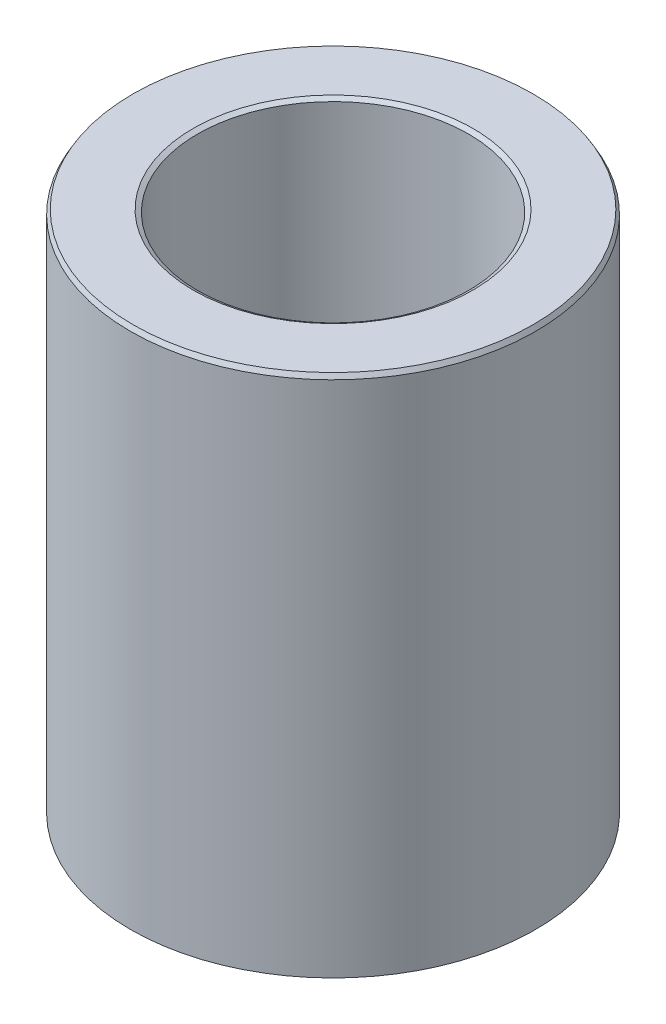
from build123d import *
from OCP.BRepFilletAPI import BRepFilletAPI_MakeChamfer

# Parameters (mm, degrees)
SKETCH1_R           = 40
BOSS_EXTRUDE1_DEPTH = 103.689007671
SKETCH2_R           = 26.766867874
CUT_EXTRUDE1_DEPTH  = 119.116088285
CHAMFER1_SIZE       = 0.879911126
CHAMFER1_SIZE2      = 0.508016925


with BuildPart() as part:
    # Sketch1 → Boss-Extrude1 (new body)
    with BuildSketch(Plane(origin=(0, 0, 0), x_dir=(1, 0, 0), z_dir=(0, 1, 0))):
        Circle(SKETCH1_R)
    extrude(amount=BOSS_EXTRUDE1_DEPTH)

    # Sketch2 → Cut-Extrude1 (cut, through all)
    with BuildSketch(Plane(origin=(0, 0, 0), x_dir=(1, 0, 0), z_dir=(0, 1, 0))):
        Circle(SKETCH2_R)
    extrude(amount=CUT_EXTRUDE1_DEPTH, mode=Mode.SUBTRACT)

    # Chamfer1: one chamfer whose edges measure the first distance from different faces: ONE call of the kernel's chamfer builder (chamfer() names one face for all edges)
    chamfer1_edges_1 = [part.edges().sort_by_distance(p)[0] for p in [
        (-26.766867874, 103.689007671, 0),
    ]]
    chamfer1_side_1 = [part.faces().sort_by_distance(p)[0] for p in [
        (-38.86862915, 103.689007671, 0),
    ]]
    chamfer1_edges_2 = [part.edges().sort_by_distance(p)[0] for p in [
        (-26.766867874, 0, 0),
    ]]
    chamfer1_side_2 = [part.faces().sort_by_distance(p)[0] for p in [
        (-26.766867874, 51.844503836, 0),
    ]]
    chamfer1_edges_3 = [part.edges().sort_by_distance(p)[0] for p in [
        (-40, 0, 0),
    ]]
    chamfer1_side_3 = [part.faces().sort_by_distance(p)[0] for p in [
        (-38.86862915, 0, 0),
    ]]
    chamfer1_edges_4 = [part.edges().sort_by_distance(p)[0] for p in [
        (-40, 103.689007671, 0),
    ]]
    chamfer1_side_4 = [part.faces().sort_by_distance(p)[0] for p in [
        (-40, 51.844503836, 0),
    ]]
    chamfer1 = BRepFilletAPI_MakeChamfer(part.part.solid().wrapped)
    for e in chamfer1_edges_1:
        chamfer1.Add(CHAMFER1_SIZE, CHAMFER1_SIZE2, e.wrapped, chamfer1_side_1[0].wrapped)  # the first distance lies on this face
    for e in chamfer1_edges_2:
        chamfer1.Add(CHAMFER1_SIZE, CHAMFER1_SIZE2, e.wrapped, chamfer1_side_2[0].wrapped)  # the first distance lies on this face
    for e in chamfer1_edges_3:
        chamfer1.Add(CHAMFER1_SIZE, CHAMFER1_SIZE2, e.wrapped, chamfer1_side_3[0].wrapped)  # the first distance lies on this face
    for e in chamfer1_edges_4:
        chamfer1.Add(CHAMFER1_SIZE, CHAMFER1_SIZE2, e.wrapped, chamfer1_side_4[0].wrapped)  # the first distance lies on this face
    add(Compound.cast(chamfer1.Shape()), mode=Mode.REPLACE)


solid = part.part
